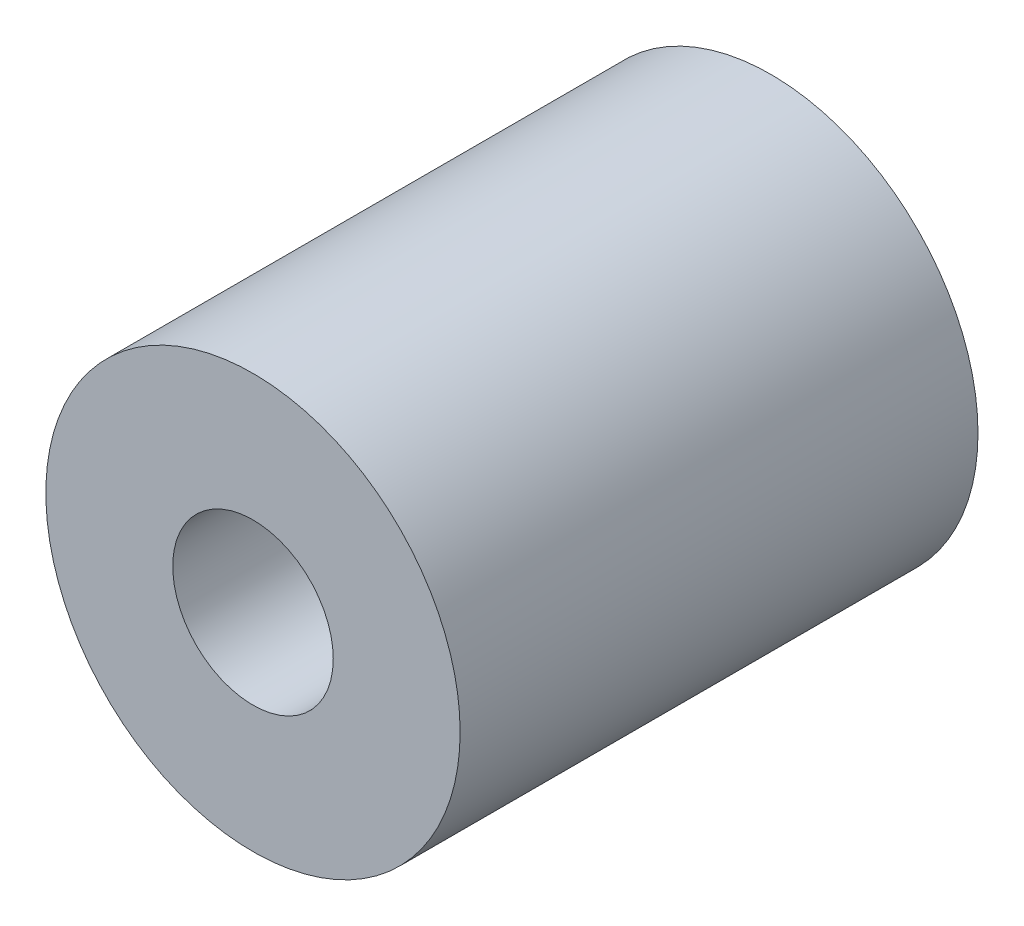
from build123d import *

# Parameters (mm, degrees)
SKETCH_1_R      = 8
SKETCH_1_R_2    = 3.1
EXTRUDE_1_DEPTH = 10


with BuildPart() as part:
    # 草图1 → 凸台-拉伸1 (new, symmetric)
    with BuildSketch(Plane.XY):
        Circle(SKETCH_1_R)
        Circle(SKETCH_1_R_2, mode=Mode.SUBTRACT)
    extrude(amount=EXTRUDE_1_DEPTH, both=True)


solid = part.part
